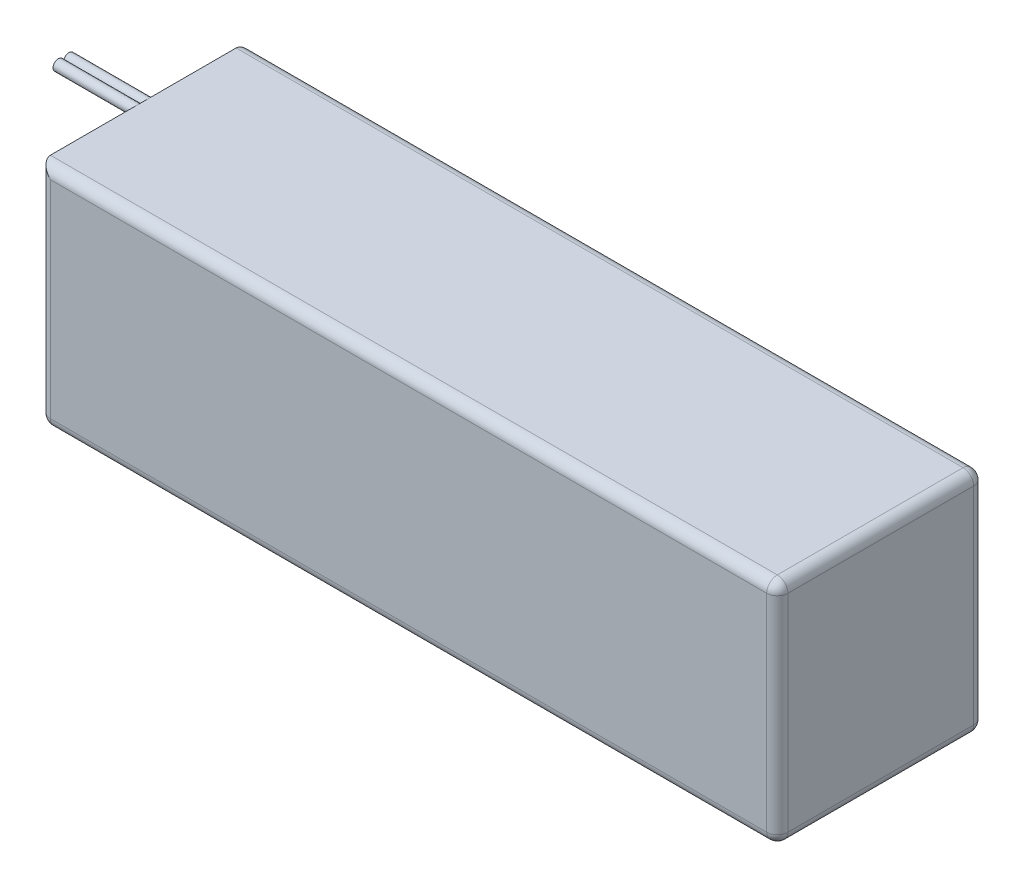
from build123d import *

# Parameters (mm, degrees)
SKETCH1_W             = 139
SKETCH1_H             = 43
BOSS_EXTRUDE1_DEPTH   = 39
SKETCH2_R             = 1
BOSS_EXTRUDE4_DEPTH   = 15
BOSS_EXTRUDE4_2_DEPTH = 15
FILLET1_R             = 2


with BuildPart() as part:
    # Sketch1 → Boss-Extrude1 (new body)
    with BuildSketch(Plane.XY):
        Rectangle(SKETCH1_W, SKETCH1_H)
    extrude(amount=BOSS_EXTRUDE1_DEPTH)

    # Fillet1
    fillet1_edges = [part.edges().sort_by_distance(p)[0] for p in [
        (-69.5, 0, 0),
        (-69.5, -21.5, 19.5),
        (0, -21.5, 0),
        (69.5, -21.5, 19.5),
        (69.5, 0, 0),
        (0, -21.5, 39),
        (-69.5, 0, 39),
        (69.5, 0, 39),
        (69.5, 21.5, 19.5),
        (0, 21.5, 39),
        (0, 21.5, 0),
    ]]
    fillet(fillet1_edges, radius=FILLET1_R)


with BuildPart() as body_2:
    # Sketch2 → Boss-Extrude4 (new body)
    with BuildSketch(Plane.ZY.offset(69.5)):
        with Locations((18.495, 20.5)):
            Circle(SKETCH2_R)
    extrude(amount=BOSS_EXTRUDE4_DEPTH)


with BuildPart() as body_3:
    # Sketch2 → Boss-Extrude4 2 (new body)
    with BuildSketch(Plane.ZY.offset(69.5)):
        with Locations((20.505, 20.5)):
            Circle(SKETCH2_R)
    extrude(amount=BOSS_EXTRUDE4_2_DEPTH)


solid = Compound([part.part, body_2.part, body_3.part])
